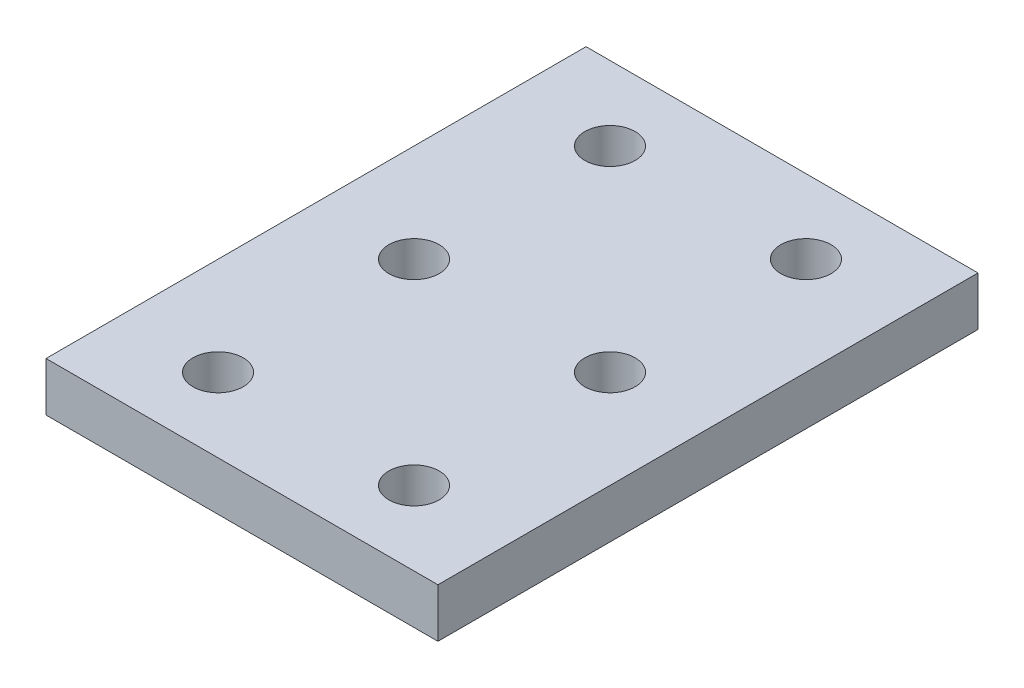
from build123d import *

# Parameters (mm, degrees)
SKETCH1_W           = 25.4
SKETCH1_H           = 35
SKETCH1_R           = 1.63
BOSS_EXTRUDE2_DEPTH = 3.175


with BuildPart() as part:
    # Sketch1 → Boss-Extrude2 (new body)
    with BuildSketch(Plane(origin=(0, 0, 0), x_dir=(1, 0, 0), z_dir=(0, 1, 0))):
        with Locations((49.8, 0)):
            Rectangle(SKETCH1_W, SKETCH1_H)
        with Locations((43.45, -12.7)):
            Circle(SKETCH1_R, mode=Mode.SUBTRACT)
        with Locations((56.15, -12.7)):
            Circle(SKETCH1_R, mode=Mode.SUBTRACT)
        with Locations((43.45, 0)):
            Circle(SKETCH1_R, mode=Mode.SUBTRACT)
        with Locations((43.45, 12.7)):
            Circle(SKETCH1_R, mode=Mode.SUBTRACT)
        with Locations((56.15, 0)):
            Circle(SKETCH1_R, mode=Mode.SUBTRACT)
        with Locations((56.15, 12.7)):
            Circle(SKETCH1_R, mode=Mode.SUBTRACT)
    extrude(amount=BOSS_EXTRUDE2_DEPTH)


solid = part.part
